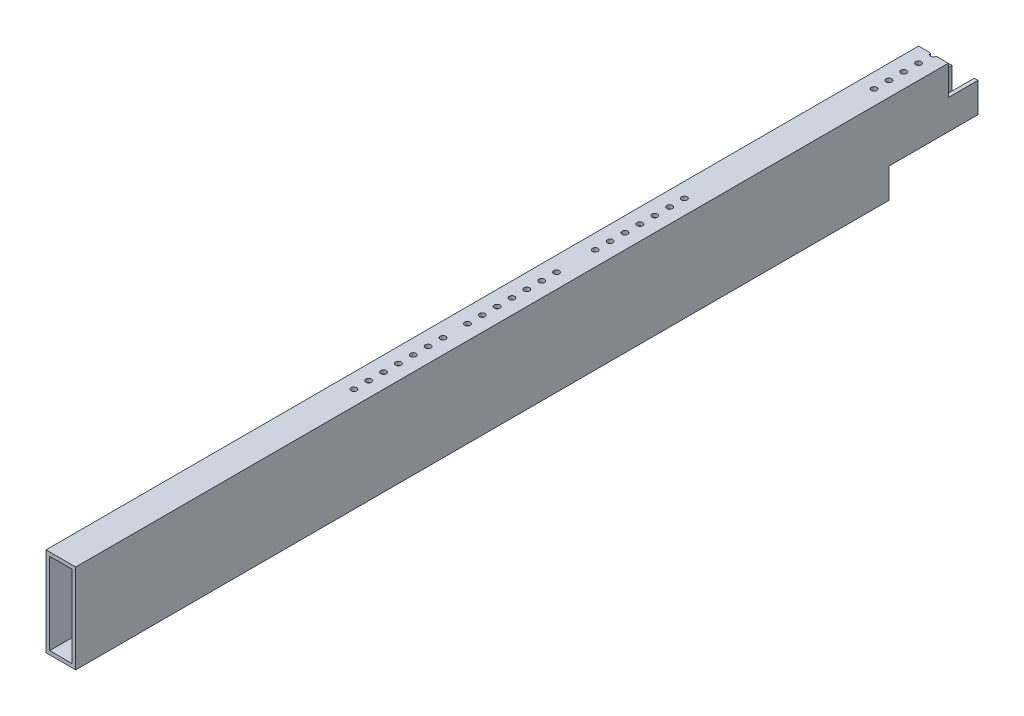
from build123d import *

# Parameters (mm, degrees)
SKETCH1_W           = 25.4
SKETCH1_H           = 76.2
BOSS_EXTRUDE1_DEPTH = 385.699
SHELL1_T            = -3.175
SKETCH2_W           = 76.2
SKETCH2_H           = 25.4
CUT_EXTRUDE1_DEPTH  = 389.407632007
SKETCH3_W           = 25.4
SKETCH3_H           = 25.4
CUT_EXTRUDE2_DEPTH  = 389.407632007
SKETCH4_R           = 2.38125
CUT_EXTRUDE3_DEPTH  = 394.359185225
CUT_EXTRUDE4_REACH  = 395.359
SKETCH5_R           = 2.38125
CUT_EXTRUDE5_REACH  = 395.359
SKETCH6_R           = 2.38125


with BuildPart() as part:
    # Sketch1 → Boss-Extrude1 (new, symmetric)
    with BuildSketch(Plane.XY):
        Rectangle(SKETCH1_W, SKETCH1_H)
    extrude(amount=BOSS_EXTRUDE1_DEPTH, both=True)

    # Shell1
    shell1_openings = [part.faces().sort_by_distance(p)[0] for p in [
        (0, 0, -385.699),
        (0, 0, 385.699),
    ]]
    offset(amount=SHELL1_T, openings=shell1_openings, kind=Kind.INTERSECTION)

    # Sketch2 → Cut-Extrude1 (cut, through all)
    with BuildSketch(Plane(origin=(12.7, 0, 0), x_dir=(0, 0, -1), z_dir=(1, 0, 0))):
        with Locations((347.599, -25.4)):
            Rectangle(SKETCH2_W, SKETCH2_H)
    extrude(amount=-CUT_EXTRUDE1_DEPTH, mode=Mode.SUBTRACT)

    # Sketch3 → Cut-Extrude2 (cut, through all)
    with BuildSketch(Plane(origin=(12.7, 0, 0), x_dir=(0, 0, -1), z_dir=(1, 0, 0))):
        with Locations((372.999, 25.4)):
            Rectangle(SKETCH3_W, SKETCH3_H)
    extrude(amount=-CUT_EXTRUDE2_DEPTH, mode=Mode.SUBTRACT)

    # Sketch4 → Cut-Extrude3 (cut, through all)
    with BuildSketch(Plane(origin=(0, 38.1, 0), x_dir=(1, 0, 0), z_dir=(0, 1, 0))):
        with Locations((0, 147.394483214)):
            Circle(SKETCH4_R)
        with Locations((0, 134.694483214)):
            Circle(SKETCH4_R)
        with Locations((0, 121.994483214)):
            Circle(SKETCH4_R)
        with Locations((0, 109.294483214)):
            Circle(SKETCH4_R)
        with Locations((0, 96.594483214)):
            Circle(SKETCH4_R)
        with Locations((0, 83.894483214)):
            Circle(SKETCH4_R)
        with Locations((0, 71.194483214)):
            Circle(SKETCH4_R)
        with Locations((0, 38.09873)):
            Circle(SKETCH4_R)
        with Locations((0, 25.39873)):
            Circle(SKETCH4_R)
        with Locations((0, 12.69873)):
            Circle(SKETCH4_R)
        with Locations((0, -0.00127)):
            Circle(SKETCH4_R)
        with Locations((0, -12.70127)):
            Circle(SKETCH4_R)
        with Locations((0, -25.40127)):
            Circle(SKETCH4_R)
        with Locations((0, -38.10127)):
            Circle(SKETCH4_R)
        with Locations((0, -58.99324371)):
            Circle(SKETCH4_R)
        with Locations((0, -71.69324371)):
            Circle(SKETCH4_R)
        with Locations((0, -84.39324371)):
            Circle(SKETCH4_R)
        with Locations((0, -97.09324371)):
            Circle(SKETCH4_R)
        with Locations((0, -109.79324371)):
            Circle(SKETCH4_R)
        with Locations((0, -122.49324371)):
            Circle(SKETCH4_R)
        with Locations((0, -135.19324371)):
            Circle(SKETCH4_R)
    extrude(amount=-CUT_EXTRUDE3_DEPTH, mode=Mode.SUBTRACT)

    # Sketch5 → Cut-Extrude4 (cut, up to next)
    with BuildSketch(Plane(origin=(0, 38.1, 0), x_dir=(1, 0, 0), z_dir=(0, 1, 0)), mode=Mode.PRIVATE) as cut_extrude4_sk1:
        with Locations((0, 360.299)):
            Circle(SKETCH5_R)
    cut_extrude4_tool1 = extrude(cut_extrude4_sk1.sketch, amount=-CUT_EXTRUDE4_REACH, mode=Mode.PRIVATE) & part.part
    # Sketch5 → Cut-Extrude4 (cut, up to next)
    with BuildSketch(Plane(origin=(0, 38.1, 0), x_dir=(1, 0, 0), z_dir=(0, 1, 0)), mode=Mode.PRIVATE) as cut_extrude4_sk2:
        with Locations((0, 347.599)):
            Circle(SKETCH5_R)
    cut_extrude4_tool2 = extrude(cut_extrude4_sk2.sketch, amount=-CUT_EXTRUDE4_REACH, mode=Mode.PRIVATE) & part.part
    # Sketch5 → Cut-Extrude4 (cut, up to next)
    with BuildSketch(Plane(origin=(0, 38.1, 0), x_dir=(1, 0, 0), z_dir=(0, 1, 0)), mode=Mode.PRIVATE) as cut_extrude4_sk3:
        with Locations((0, 334.899)):
            Circle(SKETCH5_R)
    cut_extrude4_tool3 = extrude(cut_extrude4_sk3.sketch, amount=-CUT_EXTRUDE4_REACH, mode=Mode.PRIVATE) & part.part
    # Sketch5 → Cut-Extrude4 (cut, up to next)
    with BuildSketch(Plane(origin=(0, 38.1, 0), x_dir=(1, 0, 0), z_dir=(0, 1, 0)), mode=Mode.PRIVATE) as cut_extrude4_sk4:
        with Locations((0, 322.199)):
            Circle(SKETCH5_R)
    cut_extrude4_tool4 = extrude(cut_extrude4_sk4.sketch, amount=-CUT_EXTRUDE4_REACH, mode=Mode.PRIVATE) & part.part
    # Sketch5 → Cut-Extrude4 (cut, up to next)
    with BuildSketch(Plane(origin=(0, 38.1, 0), x_dir=(1, 0, 0), z_dir=(0, 1, 0)), mode=Mode.PRIVATE) as cut_extrude4_sk5:
        with Locations((0, 309.499)):
            Circle(SKETCH5_R)
    cut_extrude4_tool5 = extrude(cut_extrude4_sk5.sketch, amount=-CUT_EXTRUDE4_REACH, mode=Mode.PRIVATE) & part.part
    add(cut_extrude4_tool1.solids().sort_by_distance((0, 38.1, -360.299))[0], mode=Mode.SUBTRACT)
    add(cut_extrude4_tool2.solids().sort_by_distance((0, 38.1, -347.599))[0], mode=Mode.SUBTRACT)
    add(cut_extrude4_tool3.solids().sort_by_distance((0, 38.1, -334.899))[0], mode=Mode.SUBTRACT)
    add(cut_extrude4_tool4.solids().sort_by_distance((0, 38.1, -322.199))[0], mode=Mode.SUBTRACT)
    add(cut_extrude4_tool5.solids().sort_by_distance((0, 38.1, -309.499))[0], mode=Mode.SUBTRACT)

    # Sketch6 → Cut-Extrude5 (cut, up to next)
    with BuildSketch(Plane.XZ.offset(38.1), mode=Mode.PRIVATE) as cut_extrude5_sk1:
        with Locations((0, -309.499)):
            Circle(SKETCH6_R)
    cut_extrude5_tool1 = extrude(cut_extrude5_sk1.sketch, amount=-CUT_EXTRUDE5_REACH, mode=Mode.PRIVATE) & part.part
    # Sketch6 → Cut-Extrude5 (cut, up to next)
    with BuildSketch(Plane.XZ.offset(38.1), mode=Mode.PRIVATE) as cut_extrude5_sk2:
        with Locations((0, -296.799)):
            Circle(SKETCH6_R)
    cut_extrude5_tool2 = extrude(cut_extrude5_sk2.sketch, amount=-CUT_EXTRUDE5_REACH, mode=Mode.PRIVATE) & part.part
    # Sketch6 → Cut-Extrude5 (cut, up to next)
    with BuildSketch(Plane.XZ.offset(38.1), mode=Mode.PRIVATE) as cut_extrude5_sk3:
        with Locations((0, -284.099)):
            Circle(SKETCH6_R)
    cut_extrude5_tool3 = extrude(cut_extrude5_sk3.sketch, amount=-CUT_EXTRUDE5_REACH, mode=Mode.PRIVATE) & part.part
    # Sketch6 → Cut-Extrude5 (cut, up to next)
    with BuildSketch(Plane.XZ.offset(38.1), mode=Mode.PRIVATE) as cut_extrude5_sk4:
        with Locations((0, -258.699)):
            Circle(SKETCH6_R)
    cut_extrude5_tool4 = extrude(cut_extrude5_sk4.sketch, amount=-CUT_EXTRUDE5_REACH, mode=Mode.PRIVATE) & part.part
    # Sketch6 → Cut-Extrude5 (cut, up to next)
    with BuildSketch(Plane.XZ.offset(38.1), mode=Mode.PRIVATE) as cut_extrude5_sk5:
        with Locations((0, -271.399)):
            Circle(SKETCH6_R)
    cut_extrude5_tool5 = extrude(cut_extrude5_sk5.sketch, amount=-CUT_EXTRUDE5_REACH, mode=Mode.PRIVATE) & part.part
    add(cut_extrude5_tool1.solids().sort_by_distance((0, -38.1, -309.499))[0], mode=Mode.SUBTRACT)
    add(cut_extrude5_tool2.solids().sort_by_distance((0, -38.1, -296.799))[0], mode=Mode.SUBTRACT)
    add(cut_extrude5_tool3.solids().sort_by_distance((0, -38.1, -284.099))[0], mode=Mode.SUBTRACT)
    add(cut_extrude5_tool4.solids().sort_by_distance((0, -38.1, -258.699))[0], mode=Mode.SUBTRACT)
    add(cut_extrude5_tool5.solids().sort_by_distance((0, -38.1, -271.399))[0], mode=Mode.SUBTRACT)


solid = part.part
